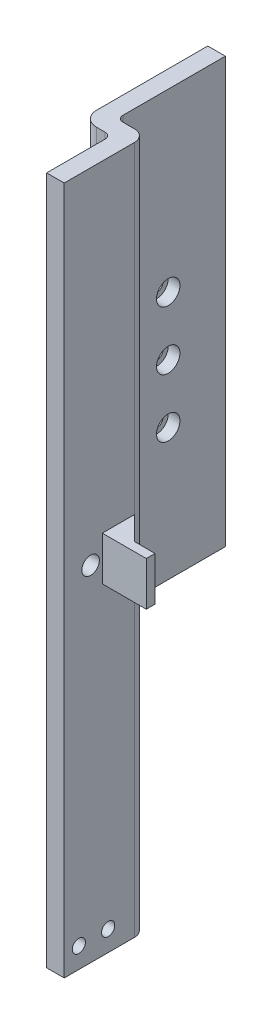
from build123d import *

# Parameters (mm, degrees)
SCHIZZO1_W                                           = 235
SCHIZZO1_H                                           = 65
ESTRUSIONE_ESTRUSIONE1_DEPTH                         = 16
SCHIZZO2_W                                           = 10
SCHIZZO2_H                                           = 37
TAGLIO_ESTRUSIONE1_DEPTH                             = 240.436839271
SCHIZZO3_W                                           = 35
SCHIZZO3_H                                           = 90
TAGLIO_ESTRUSIONE2_DEPTH                             = 240.436839271
SCHIZZO4_W                                           = 10
SCHIZZO4_H                                           = 22
TAGLIO_ESTRUSIONE3_DEPTH                             = 240.436839271
FORO_LAMATO_PER_VITE_M4_A_TESTA_ESAGONAL_D           = 4.5
FORO_LAMATO_PER_VITE_M4_A_TESTA_ESAGONAL_CBORE_D     = 8
FORO_LAMATO_PER_VITE_M4_A_TESTA_ESAGONAL_CBORE_DEPTH = 4
RACCORDO1_R                                          = 2
RACCORDO2_R                                          = 4
RACCORDO3_R                                          = 5
RACCORDO4_R                                          = 6
FORO_PER_VITE_M4_1_D                                 = 4.5
FORO_PER_VITE_M4_1_DEPTH                             = 188
FORO_PER_VITE_M4_1_TIP                               = 1.351936393
SCHIZZO9_W                                           = 3
SCHIZZO9_H                                           = 15
ESTRUSIONE_ESTRUSIONE2_DEPTH                         = 15
SCHIZZO10_R                                          = 3
TAGLIO_ESTRUSIONE4_DEPTH                             = 15
SMUSSO1_SIZE                                         = 8


with BuildPart() as part:
    # Schizzo1 → Estrusione-Estrusione1 (new body)
    with BuildSketch(Plane(origin=(0, 0, 0), x_dir=(0, -1, 0), z_dir=(-1, 0, 0))):
        with Locations((-117.5, -10.5)):
            Rectangle(SCHIZZO1_W, SCHIZZO1_H)
    extrude(amount=-ESTRUSIONE_ESTRUSIONE1_DEPTH)

    # Schizzo2 → Taglio-Estrusione1 (cut, through all)
    with BuildSketch(Plane.XZ):
        with Locations((11, -24.5)):
            Rectangle(SCHIZZO2_W, SCHIZZO2_H)
    extrude(amount=-TAGLIO_ESTRUSIONE1_DEPTH, mode=Mode.SUBTRACT)

    # Schizzo3 → Taglio-Estrusione2 (cut, through all)
    with BuildSketch(Plane.ZY):
        with Locations((-25.5, 45)):
            Rectangle(SCHIZZO3_W, SCHIZZO3_H)
    extrude(amount=-TAGLIO_ESTRUSIONE2_DEPTH, mode=Mode.SUBTRACT)

    # Schizzo4 → Taglio-Estrusione3 (cut, through all)
    with BuildSketch(Plane.XZ):
        with Locations((5, 11)):
            Rectangle(SCHIZZO4_W, SCHIZZO4_H)
    extrude(amount=-TAGLIO_ESTRUSIONE3_DEPTH, mode=Mode.SUBTRACT)

    # Foro lamato per Vite M4 a testa esagonale-1 (through all)
    with Locations(Plane(origin=(6, 0, 0), x_dir=(0, 0, -1), z_dir=(1, 0, 0))):
        with Locations((23.5, 175), (23.5, 155), (23.5, 135)):
            CounterBoreHole(FORO_LAMATO_PER_VITE_M4_A_TESTA_ESAGONAL_D / 2, FORO_LAMATO_PER_VITE_M4_A_TESTA_ESAGONAL_CBORE_D / 2, FORO_LAMATO_PER_VITE_M4_A_TESTA_ESAGONAL_CBORE_DEPTH)

    # Raccordo1
    raccordo1_edges = [part.edges().sort_by_distance(p)[0] for p in [
        (10, 117.5, 0),
        (6, 117.5, -6),
    ]]
    fillet(raccordo1_edges, radius=RACCORDO1_R)

    # Raccordo2
    raccordo2_edges = [part.edges().sort_by_distance(p)[0] for p in [
        (16, 117.5, -6),
    ]]
    fillet(raccordo2_edges, radius=RACCORDO2_R)

    # Raccordo3
    raccordo3_edges = [part.edges().sort_by_distance(p)[0] for p in [
        (0, 117.5, 0),
    ]]
    fillet(raccordo3_edges, radius=RACCORDO3_R)

    # Raccordo4
    raccordo4_edges = [part.edges().sort_by_distance(p)[0] for p in [
        (3, 90, -8),
    ]]
    fillet(raccordo4_edges, radius=RACCORDO4_R)

    # Foro per Vite M4-1
    with Locations(Plane.ZY.offset(-10)):
        with Locations((17, 7), (7, 7)):
            Hole(FORO_PER_VITE_M4_1_D / 2, depth=FORO_PER_VITE_M4_1_DEPTH)
            with Locations((0, 0, -(FORO_PER_VITE_M4_1_DEPTH + FORO_PER_VITE_M4_1_TIP / 2))):  # 118° drill point
                Cone(0, FORO_PER_VITE_M4_1_D / 2, FORO_PER_VITE_M4_1_TIP, mode=Mode.SUBTRACT)

    # Schizzo9 → Estrusione-Estrusione2 (add)
    with BuildSketch(Plane(origin=(16, 0, 0), x_dir=(0, 0, -1), z_dir=(1, 0, 0))):
        with Locations((-7.5, 117.5)):
            Rectangle(SCHIZZO9_W, SCHIZZO9_H)
    extrude(amount=ESTRUSIONE_ESTRUSIONE2_DEPTH)

    # Schizzo10 → Taglio-Estrusione4 (cut)
    with BuildSketch(Plane(origin=(16, 0, 0), x_dir=(0, 0, -1), z_dir=(1, 0, 0))):
        with Locations((-13, 117.5)):
            Circle(SCHIZZO10_R)
    extrude(amount=-TAGLIO_ESTRUSIONE4_DEPTH, mode=Mode.SUBTRACT)

    # Smusso1
    smusso1_edges = [part.edges().sort_by_distance(p)[0] for p in [
        (16, 117.5, 6),
    ]]
    chamfer(smusso1_edges, length=SMUSSO1_SIZE - 0.0001)  # a hair under: the kernel refuses the full size


solid = part.part
